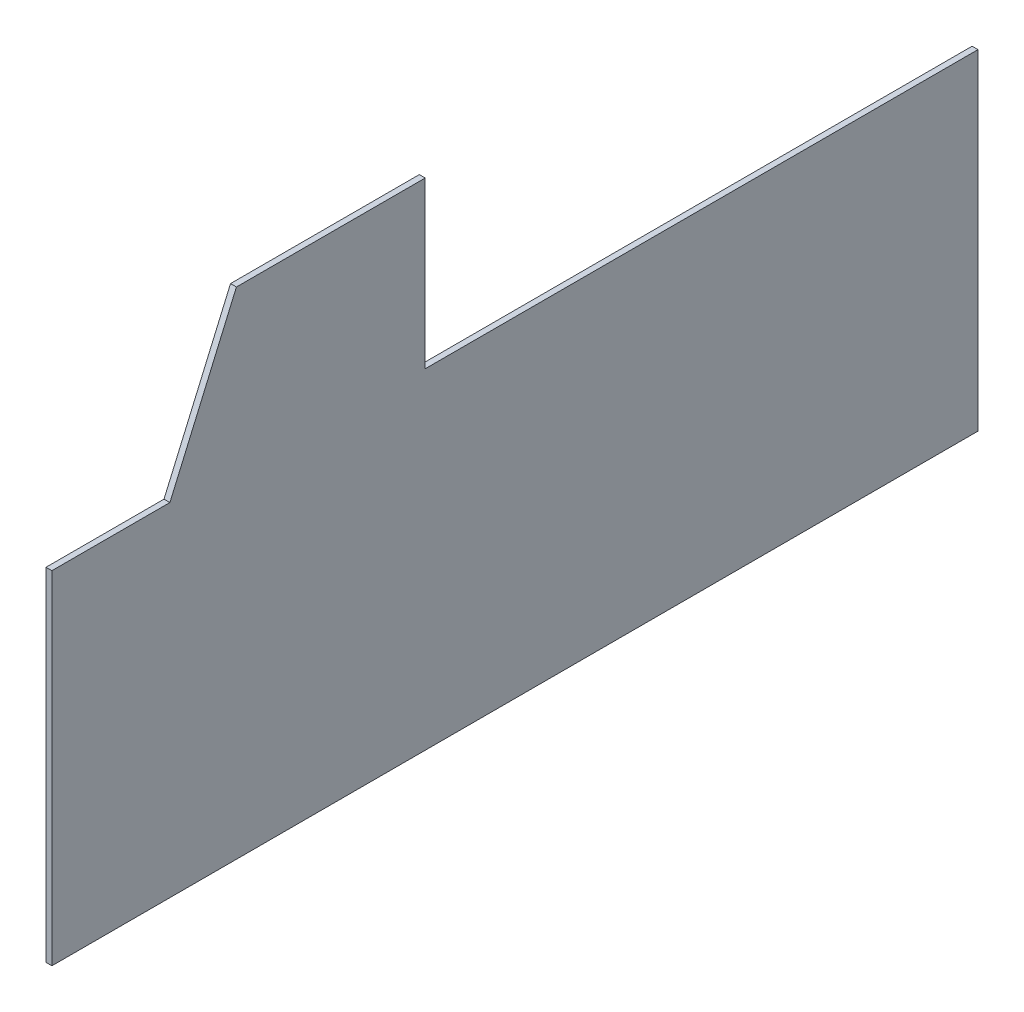
from build123d import *

# Parameters (mm, degrees)
SKETCH1_W           = 498.348
SKETCH1_H           = 177.8
BOSS_EXTRUDE1_DEPTH = 1.5875
BOSS_EXTRUDE2_DEPTH = 3.175


with BuildPart() as part:
    # Sketch1 → Boss-Extrude1 (new, symmetric)
    with BuildSketch(Plane(origin=(0, 0, 0), x_dir=(0, 0, -1), z_dir=(1, 0, 0))):
        Rectangle(SKETCH1_W, SKETCH1_H)
    extrude(amount=BOSS_EXTRUDE1_DEPTH, both=True)

    # Sketch2 → Boss-Extrude2 (add)
    with BuildSketch(Plane.ZY.offset(1.5875)):
        Polygon((48.2854, 177.8), (48.2854, 88.9), (249.174, 88.9), (249.174, 95.25), (185.674, 95.25), (149.8854, 177.8), align=None)
    extrude(amount=-BOSS_EXTRUDE2_DEPTH)


solid = part.part
